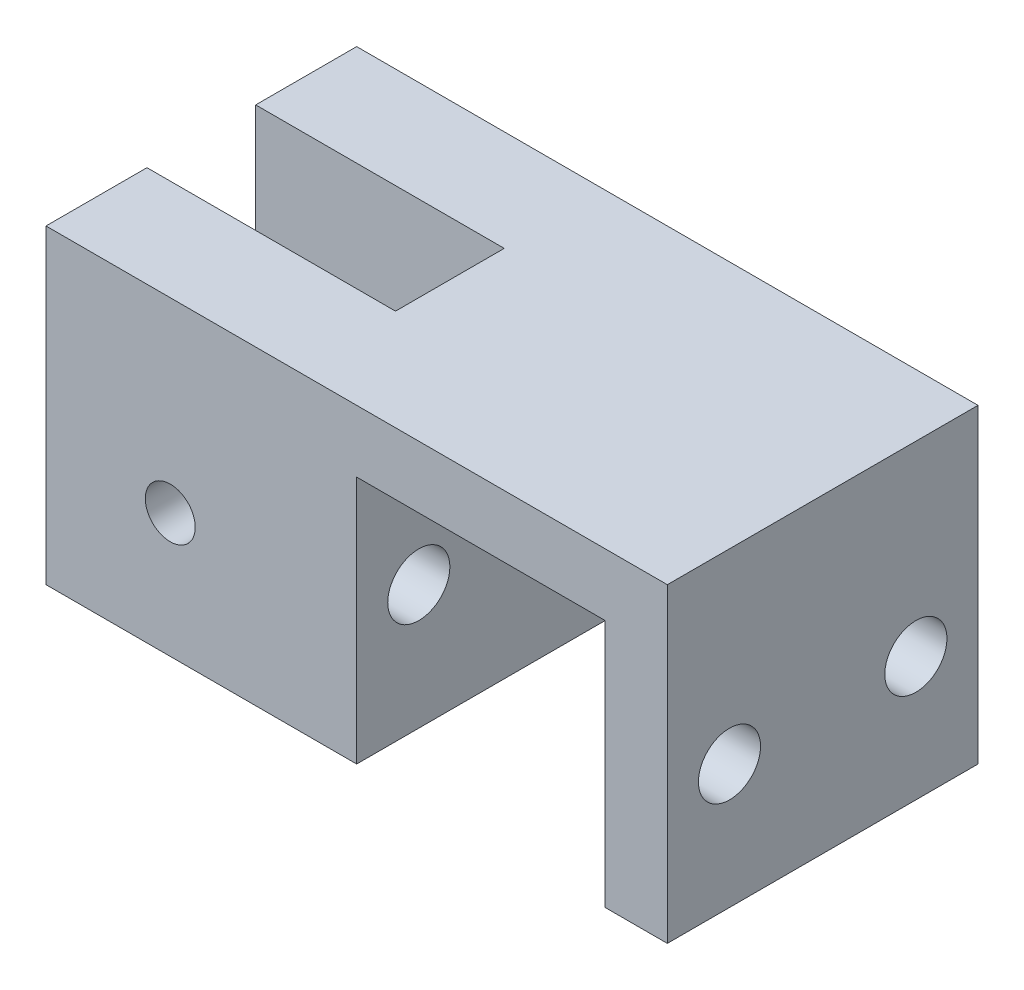
from build123d import *

# Parameters (mm, degrees)
BOSS_EXTRUDE1_DEPTH             = 15.875
SKETCH2_W                       = 25.4
SKETCH2_H                       = 11.1125
CUT_EXTRUDE1_DEPTH              = 48.625
F_1_4_0_25_DIAMETER_HOLE1_D     = 6.35
F_1_4_0_25_DIAMETER_HOLE1_DEPTH = 44.45
F_1_4_0_25_DIAMETER_HOLE1_TIP   = 1.907732465
F_10_CLEARANCE_HOLE1_D          = 5.1054


with BuildPart() as part:
    # Sketch1 → Boss-Extrude1 (new, symmetric)
    with BuildSketch(Plane.XY):
        Polygon((0, 0), (0, 25.4), (25.4, 25.4), (25.4, 0), (31.75, 0), (31.75, 31.75), (-31.75, 31.75), (-31.75, 0), align=None)
    extrude(amount=BOSS_EXTRUDE1_DEPTH, both=True)

    # Sketch2 → Cut-Extrude1 (cut, through all)
    with BuildSketch(Plane(origin=(0, 31.75, 0), x_dir=(1, 0, 0), z_dir=(0, 1, 0))):
        with Locations((-19.05, 0)):
            Rectangle(SKETCH2_W, SKETCH2_H)
    extrude(amount=-CUT_EXTRUDE1_DEPTH, mode=Mode.SUBTRACT)

    # 1/4 (0.25) Diameter Hole1
    with Locations(Plane(origin=(31.75, 0, 0), x_dir=(0, 0, -1), z_dir=(1, 0, 0))):
        with Locations((-9.525, 12.7), (9.525, 12.7)):
            Hole(F_1_4_0_25_DIAMETER_HOLE1_D / 2, depth=F_1_4_0_25_DIAMETER_HOLE1_DEPTH)
            with Locations((0, 0, -(F_1_4_0_25_DIAMETER_HOLE1_DEPTH + F_1_4_0_25_DIAMETER_HOLE1_TIP / 2))):  # 118° drill point
                Cone(0, F_1_4_0_25_DIAMETER_HOLE1_D / 2, F_1_4_0_25_DIAMETER_HOLE1_TIP, mode=Mode.SUBTRACT)

    # #10 Clearance Hole1 (through all)
    with Locations(Plane.XY.offset(15.875)):
        with Locations((-19.05, 12.7)):
            Hole(F_10_CLEARANCE_HOLE1_D / 2)


solid = part.part
